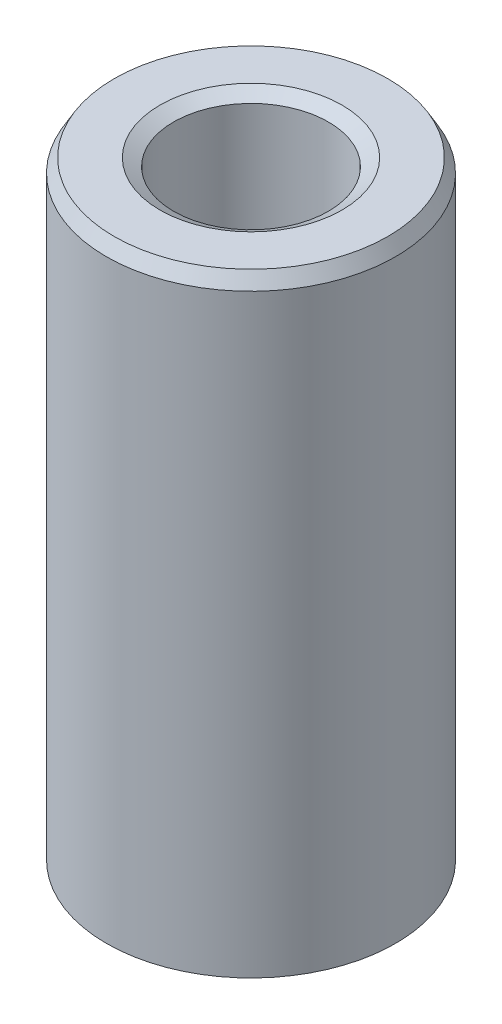
from build123d import *
from OCP.BRepFilletAPI import BRepFilletAPI_MakeChamfer

# Parameters (mm, degrees)
SKETCH1_R           = 22.5
BOSS_EXTRUDE1_DEPTH = 95.857870331
SKETCH2_R           = 12.046379251
CUT_EXTRUDE1_DEPTH  = 102.001145064
CHAMFER1_SIZE       = 2.111636665
CHAMFER1_SIZE2      = 1.219153997


with BuildPart() as part:
    # Sketch1 → Boss-Extrude1 (new body)
    with BuildSketch(Plane(origin=(0, 0, 0), x_dir=(1, 0, 0), z_dir=(0, 1, 0))):
        Circle(SKETCH1_R)
    extrude(amount=BOSS_EXTRUDE1_DEPTH)

    # Sketch2 → Cut-Extrude1 (cut, through all)
    with BuildSketch(Plane(origin=(0, 0, 0), x_dir=(1, 0, 0), z_dir=(0, 1, 0))):
        Circle(SKETCH2_R)
    extrude(amount=CUT_EXTRUDE1_DEPTH, mode=Mode.SUBTRACT)

    # Chamfer1: one chamfer whose edges measure the first distance from different faces: ONE call of the kernel's chamfer builder (chamfer() names one face for all edges)
    chamfer1_edges_1 = [part.edges().sort_by_distance(p)[0] for p in [
        (-12.046379251, 95.857870331, 0),
    ]]
    chamfer1_side_1 = [part.faces().sort_by_distance(p)[0] for p in [
        (-21.863603897, 95.857870331, 0),
    ]]
    chamfer1_edges_2 = [part.edges().sort_by_distance(p)[0] for p in [
        (-12.046379251, 0, 0),
    ]]
    chamfer1_side_2 = [part.faces().sort_by_distance(p)[0] for p in [
        (-12.046379251, 47.928935165, 0),
    ]]
    chamfer1_edges_3 = [part.edges().sort_by_distance(p)[0] for p in [
        (-22.5, 0, 0),
    ]]
    chamfer1_side_3 = [part.faces().sort_by_distance(p)[0] for p in [
        (-21.863603897, 0, 0),
    ]]
    chamfer1_edges_4 = [part.edges().sort_by_distance(p)[0] for p in [
        (-22.5, 95.857870331, 0),
    ]]
    chamfer1_side_4 = [part.faces().sort_by_distance(p)[0] for p in [
        (-22.5, 47.928935165, 0),
    ]]
    chamfer1 = BRepFilletAPI_MakeChamfer(part.part.solid().wrapped)
    for e in chamfer1_edges_1:
        chamfer1.Add(CHAMFER1_SIZE, CHAMFER1_SIZE2, e.wrapped, chamfer1_side_1[0].wrapped)  # the first distance lies on this face
    for e in chamfer1_edges_2:
        chamfer1.Add(CHAMFER1_SIZE, CHAMFER1_SIZE2, e.wrapped, chamfer1_side_2[0].wrapped)  # the first distance lies on this face
    for e in chamfer1_edges_3:
        chamfer1.Add(CHAMFER1_SIZE, CHAMFER1_SIZE2, e.wrapped, chamfer1_side_3[0].wrapped)  # the first distance lies on this face
    for e in chamfer1_edges_4:
        chamfer1.Add(CHAMFER1_SIZE, CHAMFER1_SIZE2, e.wrapped, chamfer1_side_4[0].wrapped)  # the first distance lies on this face
    add(Compound.cast(chamfer1.Shape()), mode=Mode.REPLACE)


solid = part.part
